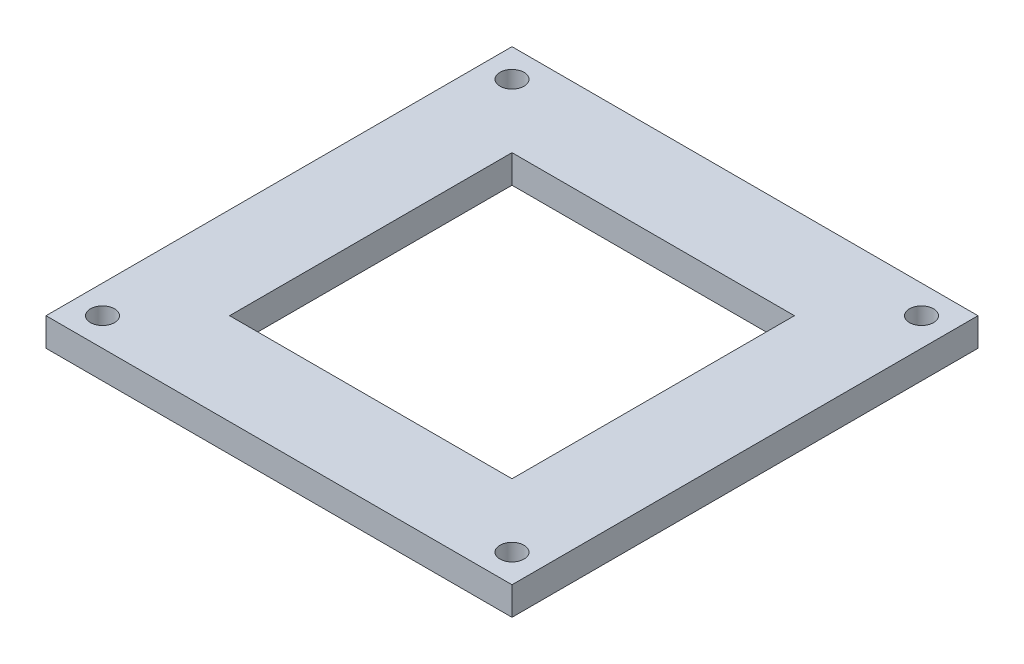
from build123d import *

# Parameters (mm, degrees)
SKETCH1_W           = 66
SKETCH1_H           = 66
SKETCH1_R           = 1.705
SKETCH1_W_2         = 40
SKETCH1_H_2         = 40
BOSS_EXTRUDE1_DEPTH = 4


with BuildPart() as part:
    # Sketch1 → Boss-Extrude1 (new body)
    with BuildSketch(Plane(origin=(0, 0, 0), x_dir=(1, 0, 0), z_dir=(0, 1, 0))):
        Rectangle(SKETCH1_W, SKETCH1_H)
        with Locations((-29, 29)):
            Circle(SKETCH1_R, mode=Mode.SUBTRACT)
        with Locations((29, 29)):
            Circle(SKETCH1_R, mode=Mode.SUBTRACT)
        with Locations((29, -29)):
            Circle(SKETCH1_R, mode=Mode.SUBTRACT)
        with Locations((-29, -29)):
            Circle(SKETCH1_R, mode=Mode.SUBTRACT)
        Rectangle(SKETCH1_W_2, SKETCH1_H_2, mode=Mode.SUBTRACT)
    extrude(amount=BOSS_EXTRUDE1_DEPTH)


solid = part.part
